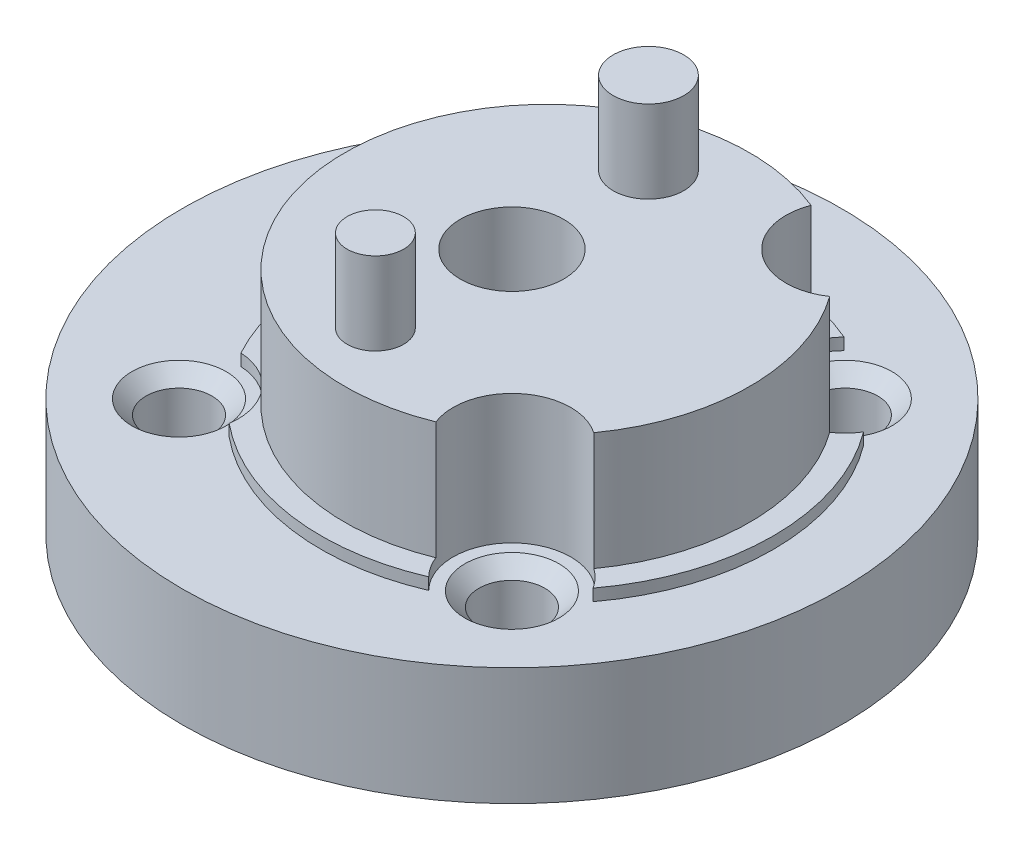
from build123d import *

# Parameters (mm, degrees)
SKETCH1_R           = 14
BOSS_EXTRUDE1_DEPTH = 5
SKETCH2_R           = 9.6
BOSS_EXTRUDE2_DEPTH = 0.5
SKETCH3_R           = 8.6
BOSS_EXTRUDE3_DEPTH = 5
SKETCH4_R           = 1.4
CUT_EXTRUDE1_DEPTH  = 21.548722588
CIRPATTERN1_COUNT   = 4
SKETCH5_R           = 2.5
CUT_EXTRUDE2_DEPTH  = 21.548722588
CHAMFER1_SIZE       = 0.6
SKETCH6_R           = 4.35
CUT_EXTRUDE3_DEPTH  = 2.5
SKETCH7_R           = 2.2
CUT_EXTRUDE4_DEPTH  = 6.5
SKETCH8_R           = 1.5
SKETCH8_R_2         = 1.2
BOSS_EXTRUDE4_DEPTH = 3.5


with BuildPart() as part:
    # Sketch1 → Boss-Extrude1 (new body)
    with BuildSketch(Plane(origin=(0, 0, 0), x_dir=(1, 0, 0), z_dir=(0, 1, 0))):
        Circle(SKETCH1_R)
    extrude(amount=BOSS_EXTRUDE1_DEPTH)

    # Sketch2 → Boss-Extrude2 (add)
    with BuildSketch(Plane(origin=(0, 5, 0), x_dir=(1, 0, 0), z_dir=(0, 1, 0))):
        with Locations((1.5, 0)):
            Circle(SKETCH2_R)
    extrude(amount=BOSS_EXTRUDE2_DEPTH)

    # Sketch3 → Boss-Extrude3 (add)
    with BuildSketch(Plane(origin=(0, 5.5, 0), x_dir=(1, 0, 0), z_dir=(0, 1, 0))):
        with Locations((1.5, 0)):
            Circle(SKETCH3_R)
    extrude(amount=BOSS_EXTRUDE3_DEPTH)

    # Sketch4 → Cut-Extrude1 (cut, through all)
    with BuildSketch(Plane(origin=(0, 5, 0), x_dir=(1, 0, 0), z_dir=(0, 1, 0))):
        with Locations((-7.071067812, 7.071067812)):
            Circle(SKETCH4_R)
    cut_extrude1 = extrude(amount=-CUT_EXTRUDE1_DEPTH, mode=Mode.SUBTRACT)

    # CirPattern1: Cut-Extrude1 ×4 about axis
    cirpattern1_axis = Axis((0, 5, 0), (0, -1, 0))
    for i in range(1, CIRPATTERN1_COUNT):
        add(cut_extrude1.rotate(cirpattern1_axis, i * 360 / CIRPATTERN1_COUNT), mode=Mode.SUBTRACT)

    # Sketch5 → Cut-Extrude2 (cut, through all)
    with BuildSketch(Plane(origin=(0, 5, 0), x_dir=(1, 0, 0), z_dir=(0, 1, 0))):
        with Locations((-7.071067812, 7.071067812)):
            Circle(SKETCH5_R)
        with Locations((7.071067812, 7.071067812)):
            Circle(SKETCH5_R)
        with Locations((7.071067812, -7.071067812)):
            Circle(SKETCH5_R)
        with Locations((-7.071067812, -7.071067812)):
            Circle(SKETCH5_R)
    extrude(amount=CUT_EXTRUDE2_DEPTH, mode=Mode.SUBTRACT)

    # Chamfer1
    chamfer1_edges = [part.edges().sort_by_distance(p)[0] for p in [
        (-7.071067812, 5, 8.471067812),
        (8.471067812, 5, 7.071067812),
        (7.071067812, 5, -8.471067812),
        (-8.471067812, 5, -7.071067812),
    ]]
    chamfer(chamfer1_edges, length=CHAMFER1_SIZE)

    # Sketch6 → Cut-Extrude3 (cut)
    with BuildSketch(Plane.XZ):
        Circle(SKETCH6_R)
    extrude(amount=-CUT_EXTRUDE3_DEPTH, mode=Mode.SUBTRACT)

    # Sketch7 → Cut-Extrude4 (cut)
    with BuildSketch(Plane(origin=(0, 10.5, 0), x_dir=(1, 0, 0), z_dir=(0, 1, 0))):
        Circle(SKETCH7_R)
    extrude(amount=-CUT_EXTRUDE4_DEPTH, mode=Mode.SUBTRACT)

    # Sketch8 → Boss-Extrude4 (add)
    with BuildSketch(Plane(origin=(0, 10.5, 0), x_dir=(1, 0, 0), z_dir=(0, 1, 0))):
        with Locations((0, 5.8)):
            Circle(SKETCH8_R)
        with Locations((0, -5.8)):
            Circle(SKETCH8_R_2)
    extrude(amount=BOSS_EXTRUDE4_DEPTH)


solid = part.part
